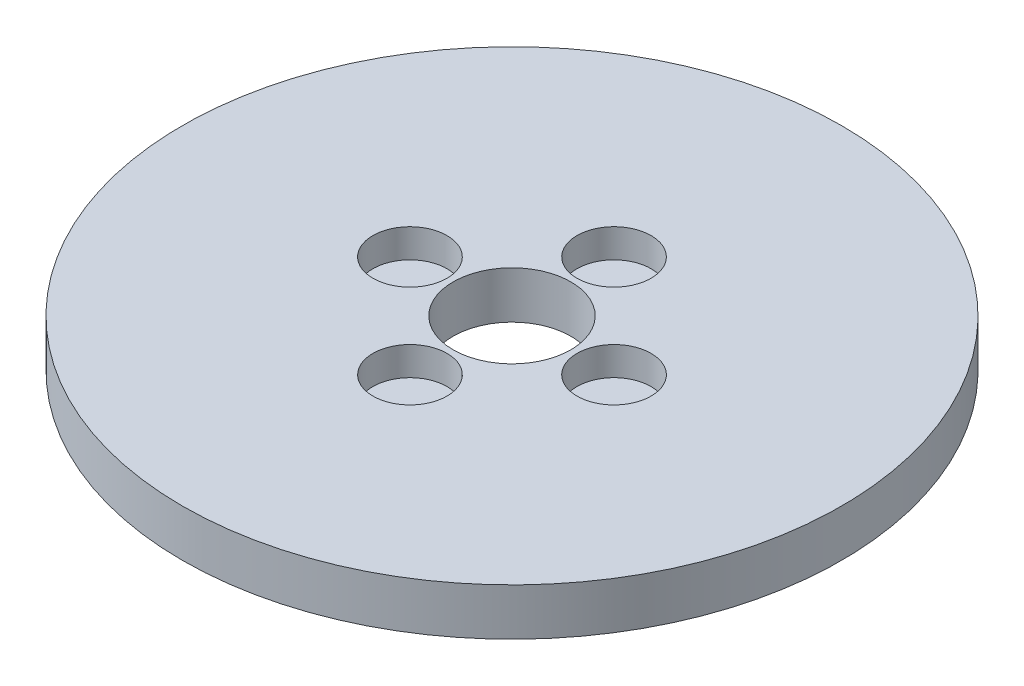
from build123d import *

# Parameters (mm, degrees)
SKETCH1_R           = 70
BOSS_EXTRUDE1_DEPTH = 10
SKETCH2_R           = 12.5
CUT_EXTRUDE1_DEPTH  = 100.498743711
SKETCH3_R           = 7.866009035
CUT_EXTRUDE2_DEPTH  = 6.101745662
CIRPATTERN1_COUNT   = 4


with BuildPart() as part:
    # Sketch1 → Boss-Extrude1 (new body)
    with BuildSketch(Plane(origin=(0, 0, 0), x_dir=(1, 0, 0), z_dir=(0, 1, 0))):
        Circle(SKETCH1_R)
    extrude(amount=BOSS_EXTRUDE1_DEPTH)

    # Sketch2 → Cut-Extrude1 (cut, through all)
    with BuildSketch(Plane(origin=(0, 0, 0), x_dir=(1, 0, 0), z_dir=(0, 1, 0))):
        Circle(SKETCH2_R)
    extrude(amount=CUT_EXTRUDE1_DEPTH, mode=Mode.SUBTRACT)

    # Sketch3 → Cut-Extrude2 (cut)
    with BuildSketch(Plane(origin=(0, 10, 0), x_dir=(1, 0, 0), z_dir=(0, 1, 0))):
        with Locations((-21.673061242, 0)):
            Circle(SKETCH3_R)
    cut_extrude2 = extrude(amount=-CUT_EXTRUDE2_DEPTH, mode=Mode.SUBTRACT)

    # CirPattern1: Cut-Extrude2 ×4 about axis
    cirpattern1_axis = Axis((0, 0, 0), (0, 1, 0))
    for i in range(1, CIRPATTERN1_COUNT):
        add(cut_extrude2.rotate(cirpattern1_axis, i * 360 / CIRPATTERN1_COUNT), mode=Mode.SUBTRACT)


solid = part.part
